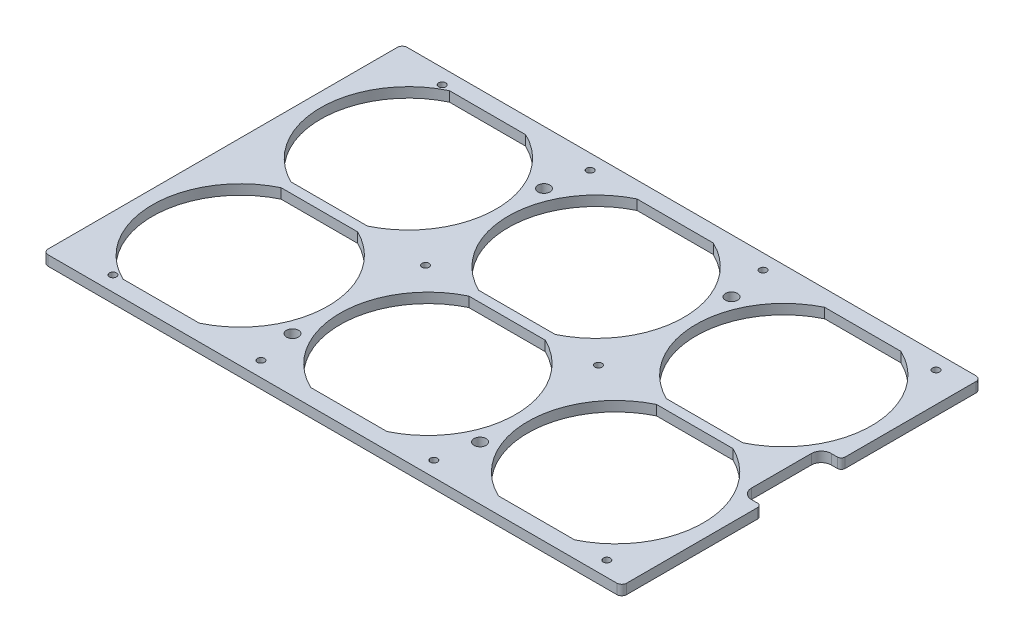
from build123d import *

# Parameters (mm, degrees)
SKETCH1_R               = 2.2479
SKETCH1_R_2             = 3.81
BOSS_EXTRUDE1_DEPTH     = 6.35
CUT_EXTRUDE1_DEPTH      = 217.831812703
CUT_EXTRUDE1_DEPTH_BACK = 217.831812703
FILLET1_R               = 2.54


with BuildPart() as part:
    # Sketch1 → Boss-Extrude1 (new body)
    with BuildSketch(Plane(origin=(0, 0, 0), x_dir=(1, 0, 0), z_dir=(0, 1, 0))):
        with BuildLine():
            Line((-180.975, 114.3), (180.975, 114.3))
            ThreePointArc((180.975, 114.3), (183.22006403, 113.37006403), (184.15, 111.125))
            Line((184.15, 111.125), (184.15, -111.125))
            ThreePointArc((184.15, -111.125), (183.22006403, -113.37006403), (180.975, -114.3))
            Line((180.975, -114.3), (-180.975, -114.3))
            ThreePointArc((-180.975, -114.3), (-183.22006403, -113.37006403), (-184.15, -111.125))
            Line((-184.15, -111.125), (-184.15, 111.125))
            ThreePointArc((-184.15, 111.125), (-183.22006403, 113.37006403), (-180.975, 114.3))
        make_face()
        with Locations((-149.225, -104.775)):
            Circle(SKETCH1_R, mode=Mode.SUBTRACT)
        with Locations((-55.033333333, -104.775)):
            Circle(SKETCH1_R, mode=Mode.SUBTRACT)
        with Locations((55.033333333, -104.775)):
            Circle(SKETCH1_R, mode=Mode.SUBTRACT)
        with Locations((165.1, -104.775)):
            Circle(SKETCH1_R, mode=Mode.SUBTRACT)
        with Locations((165.1, 104.775)):
            Circle(SKETCH1_R, mode=Mode.SUBTRACT)
        with Locations((55.033333333, 104.775)):
            Circle(SKETCH1_R, mode=Mode.SUBTRACT)
        with Locations((-55.033333333, 104.775)):
            Circle(SKETCH1_R, mode=Mode.SUBTRACT)
        with Locations((-149.225, 104.775)):
            Circle(SKETCH1_R, mode=Mode.SUBTRACT)
        with Locations((-55.033333333, 0)):
            Circle(SKETCH1_R, mode=Mode.SUBTRACT)
        with Locations((55.033333333, 0)):
            Circle(SKETCH1_R, mode=Mode.SUBTRACT)
        with Locations((-59.69, 80.01)):
            Circle(SKETCH1_R_2, mode=Mode.SUBTRACT)
        with Locations((-59.69, -80.01)):
            Circle(SKETCH1_R_2, mode=Mode.SUBTRACT)
        with Locations((59.69, -80.01)):
            Circle(SKETCH1_R_2, mode=Mode.SUBTRACT)
        with Locations((59.69, 80.01)):
            Circle(SKETCH1_R_2, mode=Mode.SUBTRACT)
        with BuildLine():
            Line((-24.3078, -3.1623), (24.3078, -3.1623))
            ThreePointArc((24.3078, -3.1623), (55.879209158, -53.5178), (24.3078, -103.8733))
            Line((24.3078, -103.8733), (-24.3078, -103.8733))
            ThreePointArc((-24.3078, -103.8733), (-55.879209158, -53.5178), (-24.3078, -3.1623))
        make_face(mode=Mode.SUBTRACT)
        with BuildLine():
            Line((95.136490842, -3.1623), (143.752090842, -3.1623))
            ThreePointArc((143.752090842, -3.1623), (175.3235, -53.5178), (143.752090842, -103.8733))
            Line((143.752090842, -103.8733), (95.136490842, -103.8733))
            ThreePointArc((95.136490842, -103.8733), (63.565081684, -53.5178), (95.136490842, -3.1623))
        make_face(mode=Mode.SUBTRACT)
        with BuildLine():
            Line((-143.752090842, -3.1623), (-95.136490842, -3.1623))
            ThreePointArc((-95.136490842, -3.1623), (-63.565081684, -53.5178), (-95.136490842, -103.8733))
            Line((-95.136490842, -103.8733), (-143.752090842, -103.8733))
            ThreePointArc((-143.752090842, -103.8733), (-175.3235, -53.5178), (-143.752090842, -3.1623))
        make_face(mode=Mode.SUBTRACT)
        with BuildLine():
            Line((-24.3078, 103.8733), (24.3078, 103.8733))
            ThreePointArc((24.3078, 103.8733), (55.879209158, 53.5178), (24.3078, 3.1623))
            Line((24.3078, 3.1623), (-24.3078, 3.1623))
            ThreePointArc((-24.3078, 3.1623), (-55.879209158, 53.5178), (-24.3078, 103.8733))
        make_face(mode=Mode.SUBTRACT)
        with BuildLine():
            Line((-143.752090842, 103.8733), (-95.136490842, 103.8733))
            ThreePointArc((-95.136490842, 103.8733), (-63.565081684, 53.5178), (-95.136490842, 3.1623))
            Line((-95.136490842, 3.1623), (-143.752090842, 3.1623))
            ThreePointArc((-143.752090842, 3.1623), (-175.3235, 53.5178), (-143.752090842, 103.8733))
        make_face(mode=Mode.SUBTRACT)
        with BuildLine():
            Line((95.136490842, 103.8733), (143.752090842, 103.8733))
            ThreePointArc((143.752090842, 103.8733), (175.3235, 53.5178), (143.752090842, 3.1623))
            Line((143.752090842, 3.1623), (95.136490842, 3.1623))
            ThreePointArc((95.136490842, 3.1623), (63.565081684, 53.5178), (95.136490842, 103.8733))
        make_face(mode=Mode.SUBTRACT)
    extrude(amount=BOSS_EXTRUDE1_DEPTH)

    # Sketch2 → Cut-Extrude1 (cut, two sides: drawn at the far end of the back side and taken through both)
    with BuildSketch(Plane(origin=(0, 6.35, 0), x_dir=(1, 0, 0), z_dir=(0, 1, 0)).offset(-CUT_EXTRUDE1_DEPTH_BACK)):
        with BuildLine():
            Line((184.15, 25.4), (177.8, 25.4))
            ThreePointArc((177.8, 25.4), (173.309871939, 23.540128061), (171.45, 19.05))
            Line((171.45, 19.05), (171.45, -19.05))
            ThreePointArc((171.45, -19.05), (173.309871939, -23.540128061), (177.8, -25.4))
            Line((177.8, -25.4), (184.15, -25.4))
            Line((184.15, -25.4), (184.15, 25.4))
        make_face()
    extrude(amount=CUT_EXTRUDE1_DEPTH + CUT_EXTRUDE1_DEPTH_BACK, mode=Mode.SUBTRACT)

    # Fillet1
    fillet1_edges = [part.edges().sort_by_distance(p)[0] for p in [
        (184.15, 3.175, 25.4),
        (184.15, 3.175, -25.4),
    ]]
    fillet(fillet1_edges, radius=FILLET1_R)


solid = part.part
